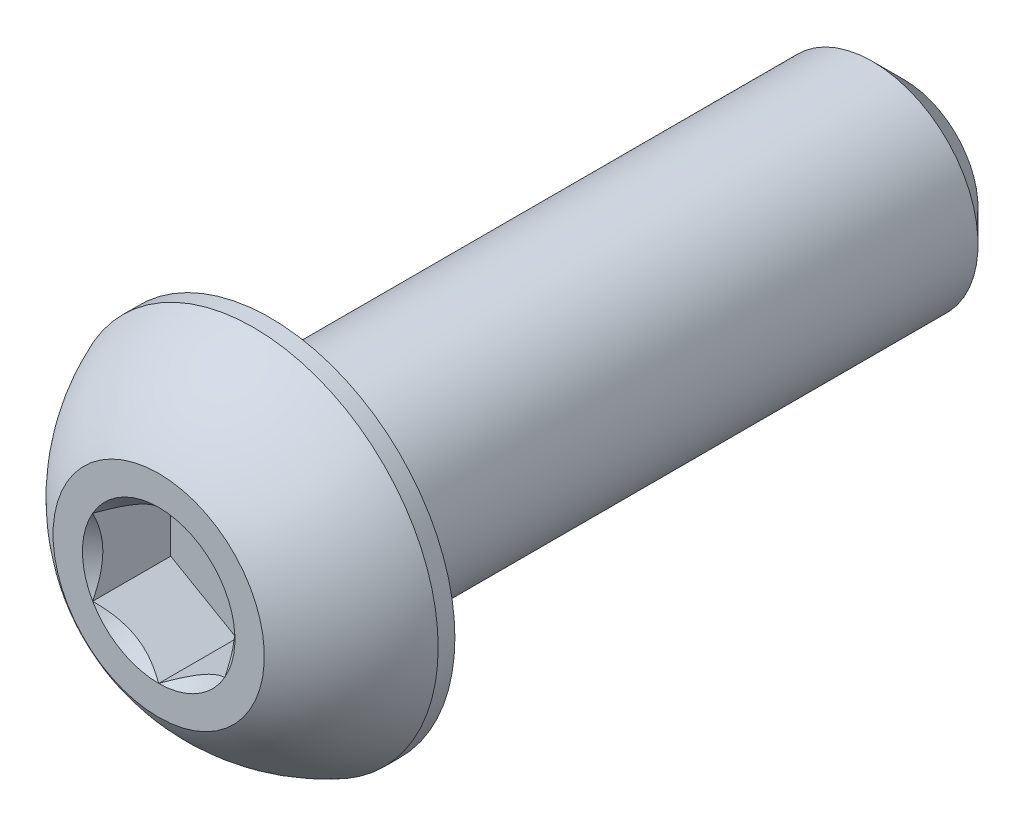
from build123d import *

# Parameters (mm, degrees)
SKETCH1_W          = 19.05
SKETCH1_H          = 3.175
CHAMFER1_SIZE      = 0.9525
CUT_EXTRUDE2_DEPTH = 2.34696


with BuildPart() as part:
    # Sketch1 → Revolve1 (revolve)
    with BuildSketch(Plane(origin=(0, 0, 0), x_dir=(0, 0, -1), z_dir=(1, 0, 0))):
        with Locations((12.8778, 1.5875)):
            Rectangle(SKETCH1_W, SKETCH1_H)
    revolve(axis=Axis((0, 0, -22.4028), (0, 0, 1)))

    # Chamfer1
    chamfer1_edges = [part.edges().sort_by_distance(p)[0] for p in [
        (0, -3.175, -22.4028),
    ]]
    chamfer(chamfer1_edges, length=CHAMFER1_SIZE)

    # Sketch7 → Revolve2 (revolve)
    with BuildSketch(Plane(origin=(0, 0, 0), x_dir=(0, 0, -1), z_dir=(1, 0, 0))):
        with BuildLine():
            Line((2.84988, 5.5499), (3.3528, 5.5499))
            Line((3.3528, 5.5499), (3.3528, 0))
            Line((3.3528, 0), (0, 0))
            Line((0, 0), (0, 3.175))
            ThreePointArc((0, 3.175), (1.235921075, 4.58927271), (2.84988, 5.5499))
        make_face()
    revolve(axis=Axis((0, 0, 0), (0, 0, -1)))

    # Sketch5 → Cut-Extrude2 (cut)
    with BuildSketch(Plane.XY):
        Polygon((1.984375, -1.14567944), (1.984375, 1.14567944), (0, 2.291358881), (-1.984375, 1.14567944), (-1.984375, -1.14567944), (0, -2.291358881), align=None)
    extrude(amount=-CUT_EXTRUDE2_DEPTH, mode=Mode.SUBTRACT)

    # Cut-Extrude3 cone 1 section (through the dimple's axis) → Cut-Extrude3 (revolve, cut)
    with BuildSketch(Plane(origin=(0, 0, 0), x_dir=(0, -1, 0), z_dir=(1, 0, 0))):
        Polygon((0, 0), (2.291358881, 0), (0, 2.291358881), align=None)
    revolve(axis=Axis((0, 0, 0), (0, 0, -1)), mode=Mode.SUBTRACT)


solid = part.part
